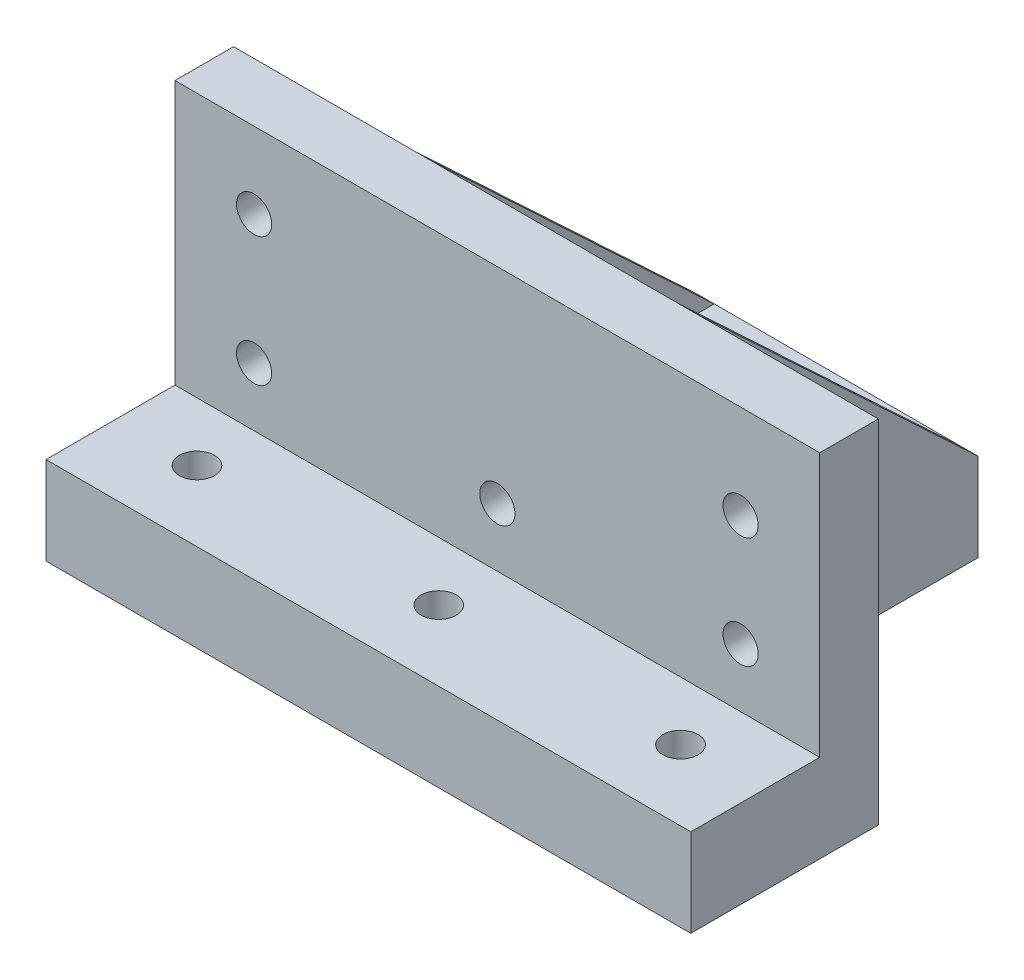
from build123d import *

# Parameters (mm, degrees)
SKETCH_1_R           = 12
SKETCH_1_R_2         = 1.75
EXTRUDE_1_DEPTH      = 15
SKETCH_2_W           = 110
SKETCH_2_H           = 10
EXTRUDE_2_DEPTH      = 45
SKETCH_5_R           = 3
CUT_EXTRUDE_2_DEPTH  = 91.47651629
SKETCH_6_R           = 5
CUT_EXTRUDE_3_DEPTH  = 10
SKETCH_7_R           = 3
CUT_EXTRUDE_4_DEPTH  = 100.944984867
SKETCH_8_R           = 5
CUT_EXTRUDE_5_DEPTH  = 5
EXTRUDE_3_DEPTH      = 3
EXTRUDE_4_DEPTH      = 3
SKETCH_14_R          = 3
CUT_EXTRUDE_9_DEPTH  = 100.944984867
SKETCH_15_R          = 5
CUT_EXTRUDE_10_DEPTH = 5


with BuildPart() as part:
    # Эскиз1 → Бобышка-Вытянуть1 (new body)
    with BuildSketch(Plane(origin=(0, 0, 0), x_dir=(1, 0, 0), z_dir=(0, 1, 0))):
        Polygon((-24, 24), (24, 24), (24, -24), (55, -24), (55, -56), (-55, -56), (-55, -24), (-24, -24), align=None)
        Circle(SKETCH_1_R, mode=Mode.SUBTRACT)
        with Locations((-16, 16)):
            Circle(SKETCH_1_R_2, mode=Mode.SUBTRACT)
        with Locations((16, 16)):
            Circle(SKETCH_1_R_2, mode=Mode.SUBTRACT)
        with Locations((16, -16)):
            Circle(SKETCH_1_R_2, mode=Mode.SUBTRACT)
        with Locations((-16, -16)):
            Circle(SKETCH_1_R_2, mode=Mode.SUBTRACT)
    extrude(amount=EXTRUDE_1_DEPTH)

    # Эскиз2 → Бобышка-Вытянуть2 (add)
    with BuildSketch(Plane(origin=(0, 15, 0), x_dir=(1, 0, 0), z_dir=(0, 1, 0))):
        with Locations((0, -29)):
            Rectangle(SKETCH_2_W, SKETCH_2_H)
    extrude(amount=EXTRUDE_2_DEPTH)

    # Эскиз5 → Вырез-Вытянуть2 (cut, through all)
    with BuildSketch(Plane(origin=(0, 15, 0), x_dir=(1, 0, 0), z_dir=(0, 1, 0))):
        with Locations((-41.25, -44)):
            Circle(SKETCH_5_R)
        with Locations((0, -44)):
            Circle(SKETCH_5_R)
        with Locations((41.25, -44)):
            Circle(SKETCH_5_R)
    extrude(amount=-CUT_EXTRUDE_2_DEPTH, mode=Mode.SUBTRACT)

    # Эскиз6 → Вырез-Вытянуть3 (cut)
    with BuildSketch(Plane.XZ):
        with Locations((-41.25, 44)):
            Circle(SKETCH_6_R)
        with Locations((0, 44)):
            Circle(SKETCH_6_R)
        with Locations((41.25, 44)):
            Circle(SKETCH_6_R)
    extrude(amount=-CUT_EXTRUDE_3_DEPTH, mode=Mode.SUBTRACT)

    # Эскиз7 → Вырез-Вытянуть4 (cut, through all)
    with BuildSketch(Plane.XY.offset(34)):
        with Locations((-41.5, 25)):
            Circle(SKETCH_7_R)
        with Locations((41.5, 25)):
            Circle(SKETCH_7_R)
        with Locations((0, 25)):
            Circle(SKETCH_7_R)
    extrude(amount=-CUT_EXTRUDE_4_DEPTH, mode=Mode.SUBTRACT)

    # Эскиз8 → Вырез-Вытянуть5 (cut)
    with BuildSketch(Plane(origin=(0, 0, 24), x_dir=(-1, 0, 0), z_dir=(0, 0, -1))):
        with Locations((-41.5, 25)):
            Circle(SKETCH_8_R)
        with Locations((0, 25)):
            Circle(SKETCH_8_R)
        with Locations((41.5, 25)):
            Circle(SKETCH_8_R)
    extrude(amount=-CUT_EXTRUDE_5_DEPTH, mode=Mode.SUBTRACT)

    # Эскиз10 → Бобышка-Вытянуть3 (add)
    with BuildSketch(Plane(origin=(24, 0, 0), x_dir=(0, 0, -1), z_dir=(1, 0, 0))):
        Polygon((-24, 15), (-24, 60), (24, 15), align=None)
    extrude(amount=-EXTRUDE_3_DEPTH)

    # Эскиз11 → Бобышка-Вытянуть4 (add)
    with BuildSketch(Plane.ZY.offset(24)):
        Polygon((24, 15), (-24, 15), (24, 60), align=None)
    extrude(amount=-EXTRUDE_4_DEPTH)

    # Эскиз14 → Вырез-Вытянуть9 (cut, through all)
    with BuildSketch(Plane.XY.offset(34)):
        with Locations((-41.5, 47.004834378)):
            Circle(SKETCH_14_R)
        with Locations((41.5, 44.004834378)):
            Circle(SKETCH_14_R)
    extrude(amount=-CUT_EXTRUDE_9_DEPTH, mode=Mode.SUBTRACT)

    # Эскиз15 → Вырез-Вытянуть10 (cut)
    with BuildSketch(Plane(origin=(0, 0, 24), x_dir=(-1, 0, 0), z_dir=(0, 0, -1))):
        with Locations((41.5, 47.004834378)):
            Circle(SKETCH_15_R)
        with Locations((-41.5, 44.004834378)):
            Circle(SKETCH_15_R)
    extrude(amount=-CUT_EXTRUDE_10_DEPTH, mode=Mode.SUBTRACT)


solid = part.part
